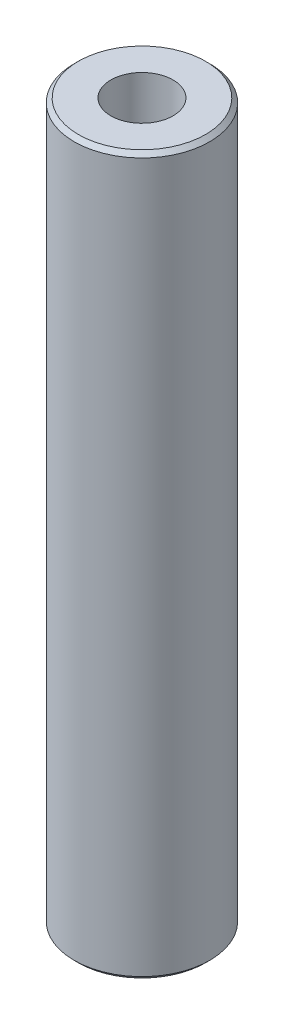
from build123d import *

# Parameters (mm, degrees)
SKETCH1_R           = 55
BOSS_EXTRUDE1_DEPTH = 582.553141541
SKETCH2_R           = 25.284344183
CUT_EXTRUDE1_DEPTH  = 588.722862171
CHAMFER1_SIZE       = 3.393994258


with BuildPart() as part:
    # Sketch1 → Boss-Extrude1 (new body)
    with BuildSketch(Plane(origin=(0, 0, 0), x_dir=(1, 0, 0), z_dir=(0, 1, 0))):
        Circle(SKETCH1_R)
    extrude(amount=BOSS_EXTRUDE1_DEPTH)

    # Sketch2 → Cut-Extrude1 (cut, through all)
    with BuildSketch(Plane(origin=(0, 0, 0), x_dir=(1, 0, 0), z_dir=(0, 1, 0))):
        Circle(SKETCH2_R)
    extrude(amount=CUT_EXTRUDE1_DEPTH, mode=Mode.SUBTRACT)

    # Chamfer1
    chamfer1_edges = [part.edges().sort_by_distance(p)[0] for p in [
        (-55, 582.553141541, 0),
        (-55, 0, 0),
    ]]
    chamfer(chamfer1_edges, length=CHAMFER1_SIZE)


solid = part.part
